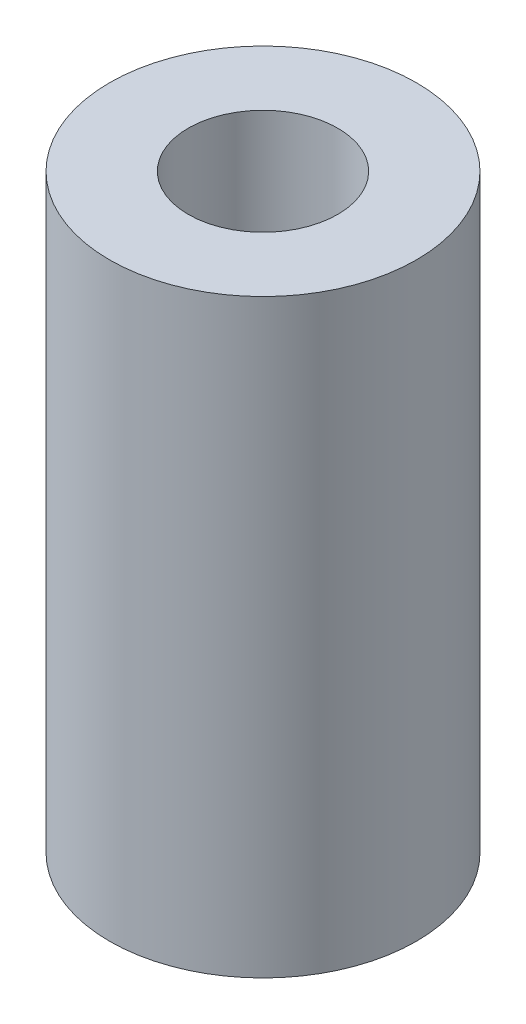
from build123d import *

# Parameters (mm, degrees)
SKETCH1_R           = 3.9
SKETCH1_R_2         = 1.9
BOSS_EXTRUDE1_DEPTH = 15


with BuildPart() as part:
    # Sketch1 → Boss-Extrude1 (new body)
    with BuildSketch(Plane(origin=(0, 0, 0), x_dir=(1, 0, 0), z_dir=(0, 1, 0))):
        Circle(SKETCH1_R)
        Circle(SKETCH1_R_2, mode=Mode.SUBTRACT)
    extrude(amount=BOSS_EXTRUDE1_DEPTH)


solid = part.part
